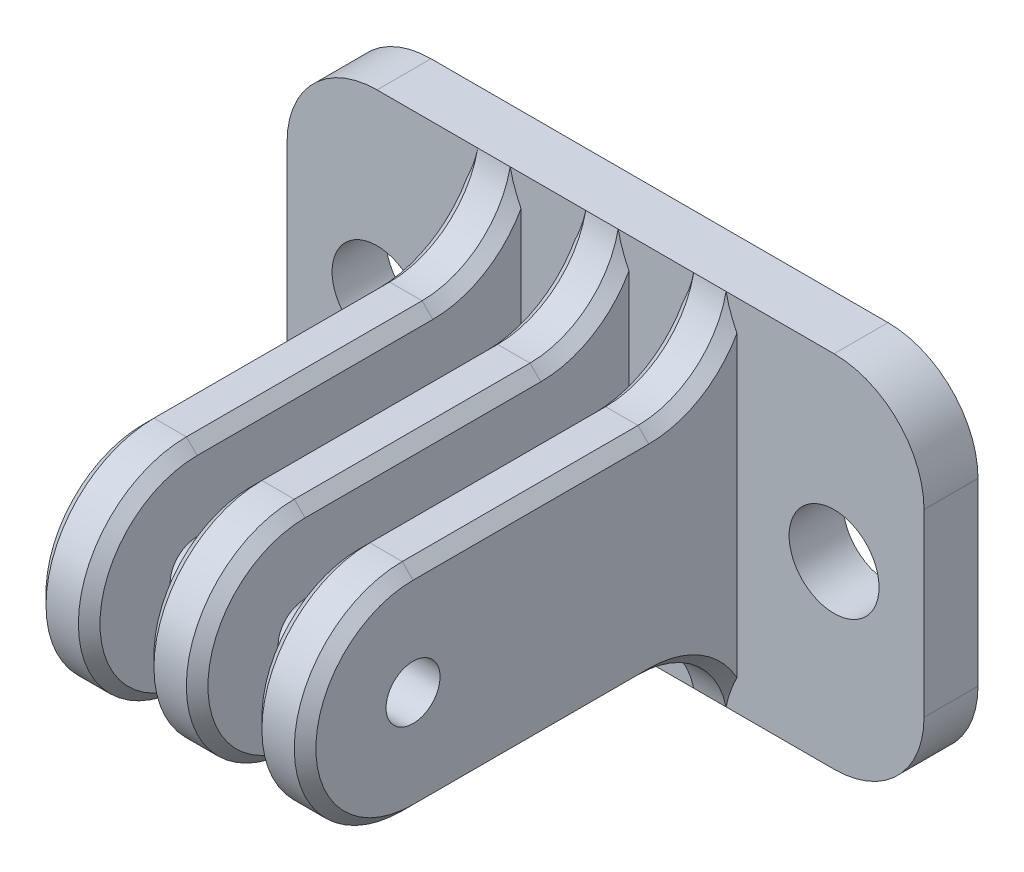
from build123d import *

# Parameters (mm, degrees)
SKETCH_1_W             = 35.4
SKETCH_1_H             = 20
SKETCH_1_R             = 2.5
EXTRUDE_1_DEPTH        = 3
EXTRUDE_START          = -10
SKETCH_3_R             = 1.5
EXTRUDE_2_DEPTH        = 3
PATTERN_LINEAR_1_COUNT = 3
PATTERN_LINEAR_1_PITCH = 6
FILLET_1_R             = 5
CHAMFER_1_SIZE         = 0.6


with BuildPart() as part:
    # 草图1 → 凸台-拉伸1 (new body)
    with BuildSketch(Plane.XY):
        with Locations((17.7, -10)):
            Rectangle(SKETCH_1_W, SKETCH_1_H)
        with Locations((5, -10)):
            Circle(SKETCH_1_R, mode=Mode.SUBTRACT)
        with Locations((30.4, -10)):
            Circle(SKETCH_1_R, mode=Mode.SUBTRACT)
    extrude(amount=EXTRUDE_1_DEPTH)

    # 草图3 → 凸台-拉伸2 (add)
    with BuildSketch(Plane.ZY.offset(EXTRUDE_START)):
        with BuildLine():
            Line((3, -4), (21, -4))
            ThreePointArc((21, -4), (27, -10), (21, -16))
            Line((21, -16), (3, -16))
            Line((3, -16), (3, -4))
        make_face()
        with Locations(Location((21, -10, 0), (0, 0, 270))):
            Circle(SKETCH_3_R, mode=Mode.SUBTRACT)
    extrude_2 = extrude(amount=-EXTRUDE_2_DEPTH)

    # 阵列(线性)1: 凸台-拉伸2 ×3
    with Locations(*[(i * PATTERN_LINEAR_1_PITCH, 0, 0) for i in range(1, PATTERN_LINEAR_1_COUNT)]):
        add(extrude_2)

    # 圆角1
    # the kernel refuses this fillet: 5 mm, written as the material it adds along each edge
    with BuildSketch(Plane(origin=(10, -16, 3), x_dir=(0, -1.0, 1.572297847473644e-12), z_dir=(1, 0, 0)), Plane(origin=(16, -16, 3), x_dir=(0, -1.0, 1.572297847473644e-12), z_dir=(1, 0, 0)), Plane(origin=(22, -16, 3), x_dir=(0, -1.0, 1.572297847473644e-12), z_dir=(1, 0, 0))) as fillet_1_piece_1:
        with BuildLine():
            CenterArc((5, -4.898979486), FILLET_1_R, 101.536959033, 78.463040967)
            Line((0, -4.898979486), (0, 0))
            Line((0, 0), (4, 0))
        make_face()
    extrude(amount=3)
    with BuildSketch(Plane(origin=(-2.247448714, -16, 3), x_dir=(0, -1.0, 1.572297847473644e-12), z_dir=(1, 0, 0))) as fillet_1_piece_2_section:
        with BuildLine():
            CenterArc((5, -4.898979486), FILLET_1_R, 101.536959033, 78.463040967)
            Line((0, -4.898979486), (0, 0))
            Line((0, 0), (4, 0))
        make_face()
    fillet_1_piece_2 = extrude(amount=27.494897428, mode=Mode.PRIVATE)
    fillet_1_piece_2 = split(fillet_1_piece_2, bisect_by=Plane(origin=(16, -16, 3), z_dir=(1, 0, 0)), keep=Keep.TOP, mode=Mode.PRIVATE)
    fillet_1_piece_2 = split(fillet_1_piece_2, bisect_by=Plane(origin=(19, -16, 3), z_dir=(-1, 0, 0)), keep=Keep.TOP, mode=Mode.PRIVATE)
    add(fillet_1_piece_2)
    with BuildSketch(Plane(origin=(-2.247448714, -16, 3), x_dir=(0, -1.0, 1.572297847473644e-12), z_dir=(1, 0, 0))) as fillet_1_piece_3_section:
        with BuildLine():
            CenterArc((5, -4.898979486), FILLET_1_R, 101.536959033, 78.463040967)
            Line((0, -4.898979486), (0, 0))
            Line((0, 0), (4, 0))
        make_face()
    fillet_1_piece_3 = extrude(amount=27.494897428, mode=Mode.PRIVATE)
    fillet_1_piece_3 = split(fillet_1_piece_3, bisect_by=Plane(origin=(25, -16, 3), z_dir=(-1, 0, 0)), keep=Keep.TOP, mode=Mode.PRIVATE)
    fillet_1_piece_3 = split(fillet_1_piece_3, bisect_by=Plane(origin=(22, -16, 3), z_dir=(1, 0, 0)), keep=Keep.TOP, mode=Mode.PRIVATE)
    add(fillet_1_piece_3)
    with BuildSketch(Plane(origin=(10, -4, 3), x_dir=(0, 1.0, 1.568078999980068e-12), z_dir=(1, 0, 0)), Plane(origin=(16, -4, 3), x_dir=(0, 1.0, 1.568078999980068e-12), z_dir=(1, 0, 0)), Plane(origin=(22, -4, 3), x_dir=(0, 1.0, 1.568078999980068e-12), z_dir=(1, 0, 0))) as fillet_1_piece_4:
        with BuildLine():
            CenterArc((5, 4.898979486), FILLET_1_R, 180, 78.463040967)
            Line((0, 4.898979486), (0, 0))
            Line((0, 0), (4, 0))
        make_face()
    extrude(amount=3)
    with BuildSketch(Plane(origin=(-2.247448714, -4, 3), x_dir=(0, 1.0, 1.568078999980068e-12), z_dir=(1, 0, 0))) as fillet_1_piece_5_section:
        with BuildLine():
            CenterArc((5, 4.898979486), FILLET_1_R, 180, 78.463040967)
            Line((0, 4.898979486), (0, 0))
            Line((0, 0), (4, 0))
        make_face()
    fillet_1_piece_5 = extrude(amount=27.494897428, mode=Mode.PRIVATE)
    fillet_1_piece_5 = split(fillet_1_piece_5, bisect_by=Plane(origin=(16, -4, 3), z_dir=(1, 0, 0)), keep=Keep.TOP, mode=Mode.PRIVATE)
    fillet_1_piece_5 = split(fillet_1_piece_5, bisect_by=Plane(origin=(19, -4, 3), z_dir=(-1, 0, 0)), keep=Keep.TOP, mode=Mode.PRIVATE)
    add(fillet_1_piece_5)
    with BuildSketch(Plane(origin=(-2.247448714, -4, 3), x_dir=(0, 1.0, 1.568078999980068e-12), z_dir=(1, 0, 0))) as fillet_1_piece_6_section:
        with BuildLine():
            CenterArc((5, 4.898979486), FILLET_1_R, 180, 78.463040967)
            Line((0, 4.898979486), (0, 0))
            Line((0, 0), (4, 0))
        make_face()
    fillet_1_piece_6 = extrude(amount=27.494897428, mode=Mode.PRIVATE)
    fillet_1_piece_6 = split(fillet_1_piece_6, bisect_by=Plane(origin=(25, -4, 3), z_dir=(-1, 0, 0)), keep=Keep.TOP, mode=Mode.PRIVATE)
    fillet_1_piece_6 = split(fillet_1_piece_6, bisect_by=Plane(origin=(22, -4, 3), z_dir=(1, 0, 0)), keep=Keep.TOP, mode=Mode.PRIVATE)
    add(fillet_1_piece_6)
    with BuildSketch(Plane(origin=(3.752551286, -16, 3), x_dir=(0, -1.0, 1.572297847473644e-12), z_dir=(1, 0, 0))) as fillet_1_piece_7_section:
        with BuildLine():
            CenterArc((5, -4.898979486), FILLET_1_R, 101.536959033, 78.463040967)
            Line((0, -4.898979486), (0, 0))
            Line((0, 0), (4, 0))
        make_face()
    fillet_1_piece_7 = extrude(amount=27.494897428, mode=Mode.PRIVATE)
    fillet_1_piece_7 = split(fillet_1_piece_7, bisect_by=Plane(origin=(10, -16, 3), z_dir=(1, 0, 0)), keep=Keep.TOP, mode=Mode.PRIVATE)
    fillet_1_piece_7 = split(fillet_1_piece_7, bisect_by=Plane(origin=(13, -16, 3), z_dir=(-1, 0, 0)), keep=Keep.TOP, mode=Mode.PRIVATE)
    add(fillet_1_piece_7)
    with BuildSketch(Plane(origin=(3.752551286, -16, 3), x_dir=(0, -1.0, 1.572297847473644e-12), z_dir=(1, 0, 0))) as fillet_1_piece_8_section:
        with BuildLine():
            CenterArc((5, -4.898979486), FILLET_1_R, 101.536959033, 78.463040967)
            Line((0, -4.898979486), (0, 0))
            Line((0, 0), (4, 0))
        make_face()
    fillet_1_piece_8 = extrude(amount=27.494897428, mode=Mode.PRIVATE)
    fillet_1_piece_8 = split(fillet_1_piece_8, bisect_by=Plane(origin=(25, -16, 3), z_dir=(-1, 0, 0)), keep=Keep.TOP, mode=Mode.PRIVATE)
    fillet_1_piece_8 = split(fillet_1_piece_8, bisect_by=Plane(origin=(22, -16, 3), z_dir=(1, 0, 0)), keep=Keep.TOP, mode=Mode.PRIVATE)
    add(fillet_1_piece_8)
    with BuildSketch(Plane(origin=(3.752551286, -4, 3), x_dir=(0, 1.0, 1.568078999980068e-12), z_dir=(1, 0, 0))) as fillet_1_piece_9_section:
        with BuildLine():
            CenterArc((5, 4.898979486), FILLET_1_R, 180, 78.463040967)
            Line((0, 4.898979486), (0, 0))
            Line((0, 0), (4, 0))
        make_face()
    fillet_1_piece_9 = extrude(amount=27.494897428, mode=Mode.PRIVATE)
    fillet_1_piece_9 = split(fillet_1_piece_9, bisect_by=Plane(origin=(10, -4, 3), z_dir=(1, 0, 0)), keep=Keep.TOP, mode=Mode.PRIVATE)
    fillet_1_piece_9 = split(fillet_1_piece_9, bisect_by=Plane(origin=(13, -4, 3), z_dir=(-1, 0, 0)), keep=Keep.TOP, mode=Mode.PRIVATE)
    add(fillet_1_piece_9)
    with BuildSketch(Plane(origin=(3.752551286, -4, 3), x_dir=(0, 1.0, 1.568078999980068e-12), z_dir=(1, 0, 0))) as fillet_1_piece_10_section:
        with BuildLine():
            CenterArc((5, 4.898979486), FILLET_1_R, 180, 78.463040967)
            Line((0, 4.898979486), (0, 0))
            Line((0, 0), (4, 0))
        make_face()
    fillet_1_piece_10 = extrude(amount=27.494897428, mode=Mode.PRIVATE)
    fillet_1_piece_10 = split(fillet_1_piece_10, bisect_by=Plane(origin=(25, -4, 3), z_dir=(-1, 0, 0)), keep=Keep.TOP, mode=Mode.PRIVATE)
    fillet_1_piece_10 = split(fillet_1_piece_10, bisect_by=Plane(origin=(22, -4, 3), z_dir=(1, 0, 0)), keep=Keep.TOP, mode=Mode.PRIVATE)
    add(fillet_1_piece_10)
    with BuildSketch(Plane(origin=(9.752551286, -16, 3), x_dir=(0, -1.0, 1.572297847473644e-12), z_dir=(1, 0, 0))) as fillet_1_piece_11_section:
        with BuildLine():
            CenterArc((5, -4.898979486), FILLET_1_R, 101.536959033, 78.463040967)
            Line((0, -4.898979486), (0, 0))
            Line((0, 0), (4, 0))
        make_face()
    fillet_1_piece_11 = extrude(amount=27.494897428, mode=Mode.PRIVATE)
    fillet_1_piece_11 = split(fillet_1_piece_11, bisect_by=Plane(origin=(10, -16, 3), z_dir=(1, 0, 0)), keep=Keep.TOP, mode=Mode.PRIVATE)
    fillet_1_piece_11 = split(fillet_1_piece_11, bisect_by=Plane(origin=(13, -16, 3), z_dir=(-1, 0, 0)), keep=Keep.TOP, mode=Mode.PRIVATE)
    add(fillet_1_piece_11)
    with BuildSketch(Plane(origin=(9.752551286, -16, 3), x_dir=(0, -1.0, 1.572297847473644e-12), z_dir=(1, 0, 0))) as fillet_1_piece_12_section:
        with BuildLine():
            CenterArc((5, -4.898979486), FILLET_1_R, 101.536959033, 78.463040967)
            Line((0, -4.898979486), (0, 0))
            Line((0, 0), (4, 0))
        make_face()
    fillet_1_piece_12 = extrude(amount=27.494897428, mode=Mode.PRIVATE)
    fillet_1_piece_12 = split(fillet_1_piece_12, bisect_by=Plane(origin=(16, -16, 3), z_dir=(1, 0, 0)), keep=Keep.TOP, mode=Mode.PRIVATE)
    fillet_1_piece_12 = split(fillet_1_piece_12, bisect_by=Plane(origin=(19, -16, 3), z_dir=(-1, 0, 0)), keep=Keep.TOP, mode=Mode.PRIVATE)
    add(fillet_1_piece_12)
    with BuildSketch(Plane(origin=(9.752551286, -4, 3), x_dir=(0, 1.0, 1.568078999980068e-12), z_dir=(1, 0, 0))) as fillet_1_piece_13_section:
        with BuildLine():
            CenterArc((5, 4.898979486), FILLET_1_R, 180, 78.463040967)
            Line((0, 4.898979486), (0, 0))
            Line((0, 0), (4, 0))
        make_face()
    fillet_1_piece_13 = extrude(amount=27.494897428, mode=Mode.PRIVATE)
    fillet_1_piece_13 = split(fillet_1_piece_13, bisect_by=Plane(origin=(10, -4, 3), z_dir=(1, 0, 0)), keep=Keep.TOP, mode=Mode.PRIVATE)
    fillet_1_piece_13 = split(fillet_1_piece_13, bisect_by=Plane(origin=(13, -4, 3), z_dir=(-1, 0, 0)), keep=Keep.TOP, mode=Mode.PRIVATE)
    add(fillet_1_piece_13)
    with BuildSketch(Plane(origin=(9.752551286, -4, 3), x_dir=(0, 1.0, 1.568078999980068e-12), z_dir=(1, 0, 0))) as fillet_1_piece_14_section:
        with BuildLine():
            CenterArc((5, 4.898979486), FILLET_1_R, 180, 78.463040967)
            Line((0, 4.898979486), (0, 0))
            Line((0, 0), (4, 0))
        make_face()
    fillet_1_piece_14 = extrude(amount=27.494897428, mode=Mode.PRIVATE)
    fillet_1_piece_14 = split(fillet_1_piece_14, bisect_by=Plane(origin=(16, -4, 3), z_dir=(1, 0, 0)), keep=Keep.TOP, mode=Mode.PRIVATE)
    fillet_1_piece_14 = split(fillet_1_piece_14, bisect_by=Plane(origin=(19, -4, 3), z_dir=(-1, 0, 0)), keep=Keep.TOP, mode=Mode.PRIVATE)
    add(fillet_1_piece_14)
    # the kernel refuses this fillet: 5 mm, written as the material it takes off along each edge
    with BuildSketch(Plane(origin=(0, 0, -12.5), x_dir=(1, 0, 0), z_dir=(0, 0, 1)), Plane(origin=(35.4, -20, -12.5), x_dir=(-1, 0, 0), z_dir=(0, 0, 1))) as fillet_1_2_piece_1:
        with BuildLine():
            CenterArc((FILLET_1_R, -FILLET_1_R), FILLET_1_R, 90, 90)
            Line((0, -FILLET_1_R), (0, 0))
            Line((0, 0), (FILLET_1_R, 0))
        make_face()
    extrude(amount=28, mode=Mode.SUBTRACT)
    with BuildSketch(Plane(origin=(35.4, 0, -12.5), x_dir=(-1, 0, 0), z_dir=(0, 0, 1)), Plane(origin=(0, -20, -12.5), x_dir=(1, 0, 0), z_dir=(0, 0, 1))) as fillet_1_2_piece_2:
        with BuildLine():
            CenterArc((FILLET_1_R, FILLET_1_R), FILLET_1_R, 180, 90)
            Line((0, FILLET_1_R), (0, 0))
            Line((0, 0), (FILLET_1_R, 0))
        make_face()
    extrude(amount=28, mode=Mode.SUBTRACT)

    # 倒角1
    chamfer_1_edges = [part.edges().sort_by_distance(p)[0] for p in [
        (13, -4, 14.449489743),
        (13, -10, 27),
        (10, -10, 27),
        (10, -4, 14.449489743),
        (19, -4, 14.449489743),
        (19, -10, 27),
        (16, -10, 27),
        (16, -4, 14.449489743),
        (25, -4, 14.449489743),
        (25, -10, 27),
        (22, -10, 27),
        (22, -4, 14.449489743),
        (10, -16, 14.449489743),
        (13, -16, 14.449489743),
        (16, -16, 14.449489743),
        (19, -16, 14.449489743),
        (22, -16, 14.449489743),
        (25, -16, 14.449489743),
        (10, -17.127016654, 4.736701825),
        (13, -17.127016654, 4.736701825),
        (16, -17.127016654, 4.736701825),
        (19, -17.127016654, 4.736701825),
        (22, -17.127016654, 4.736701825),
        (25, -17.127016654, 4.736701825),
        (10, -2.872983346, 4.736701825),
        (13, -2.872983346, 4.736701825),
        (16, -2.872983346, 4.736701825),
        (19, -2.872983346, 4.736701825),
        (22, -2.872983346, 4.736701825),
        (25, -2.872983346, 4.736701825),
    ]]
    chamfer(chamfer_1_edges, length=CHAMFER_1_SIZE)


solid = part.part
